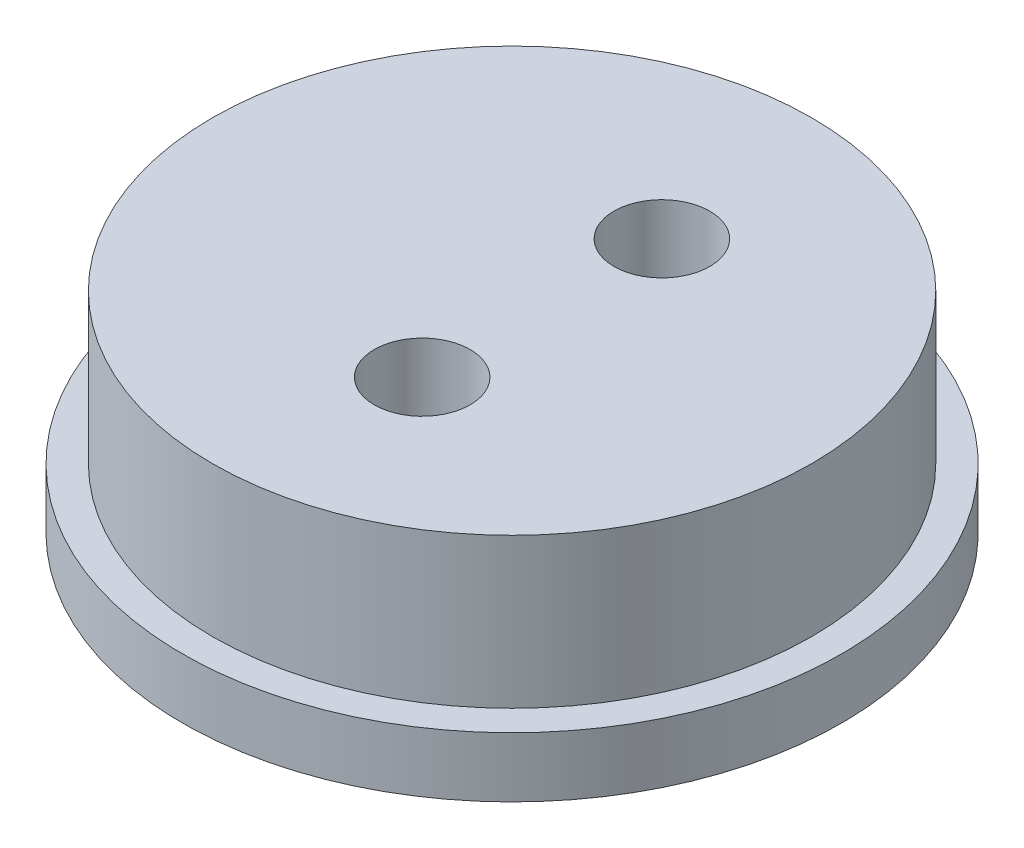
from build123d import *

# Parameters (mm, degrees)
SKETCH1_R           = 10
BOSS_EXTRUDE1_DEPTH = 7
SKETCH2_R           = 11
BOSS_EXTRUDE2_DEPTH = 2
SKETCH4_R           = 1.6
CUT_EXTRUDE1_DEPTH  = 18.720045147


with BuildPart() as part:
    # Sketch1 → Boss-Extrude1 (new body)
    with BuildSketch(Plane(origin=(0, 0, 0), x_dir=(1, 0, 0), z_dir=(0, 1, 0))):
        with Locations((-1, 0)):
            Circle(SKETCH1_R)
    extrude(amount=BOSS_EXTRUDE1_DEPTH)

    # Sketch2 → Boss-Extrude2 (add)
    with BuildSketch(Plane.XZ):
        with Locations((-1, 0)):
            Circle(SKETCH2_R)
    extrude(amount=-BOSS_EXTRUDE2_DEPTH)

    # Sketch4 → Cut-Extrude1 (cut, through all)
    with BuildSketch(Plane(origin=(0, 7, 0), x_dir=(1, 0, 0), z_dir=(0, 1, 0))):
        with Locations((0, 4)):
            Circle(SKETCH4_R)
        with Locations((0, -4)):
            Circle(SKETCH4_R)
    extrude(amount=-CUT_EXTRUDE1_DEPTH, mode=Mode.SUBTRACT)


solid = part.part
